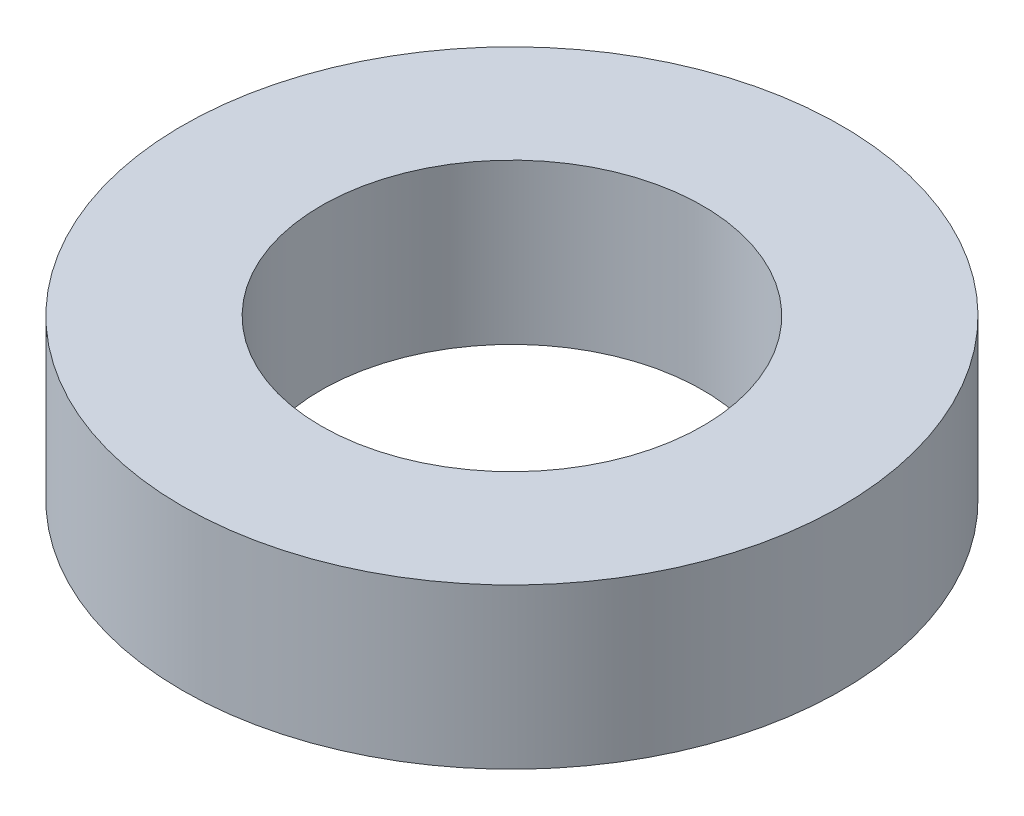
from build123d import *

# Parameters (mm, degrees)
SKETCH1_R           = 47.5
BOSS_EXTRUDE1_DEPTH = 23
SKETCH2_R           = 27.5
CUT_EXTRUDE1_DEPTH  = 72.003521039


with BuildPart() as part:
    # Sketch1 → Boss-Extrude1 (new body)
    with BuildSketch(Plane(origin=(0, 0, 0), x_dir=(1, 0, 0), z_dir=(0, 1, 0))):
        Circle(SKETCH1_R)
    extrude(amount=BOSS_EXTRUDE1_DEPTH)

    # Sketch2 → Cut-Extrude1 (cut, through all)
    with BuildSketch(Plane(origin=(0, 0, 0), x_dir=(1, 0, 0), z_dir=(0, 1, 0))):
        Circle(SKETCH2_R)
    extrude(amount=CUT_EXTRUDE1_DEPTH, mode=Mode.SUBTRACT)


solid = part.part
